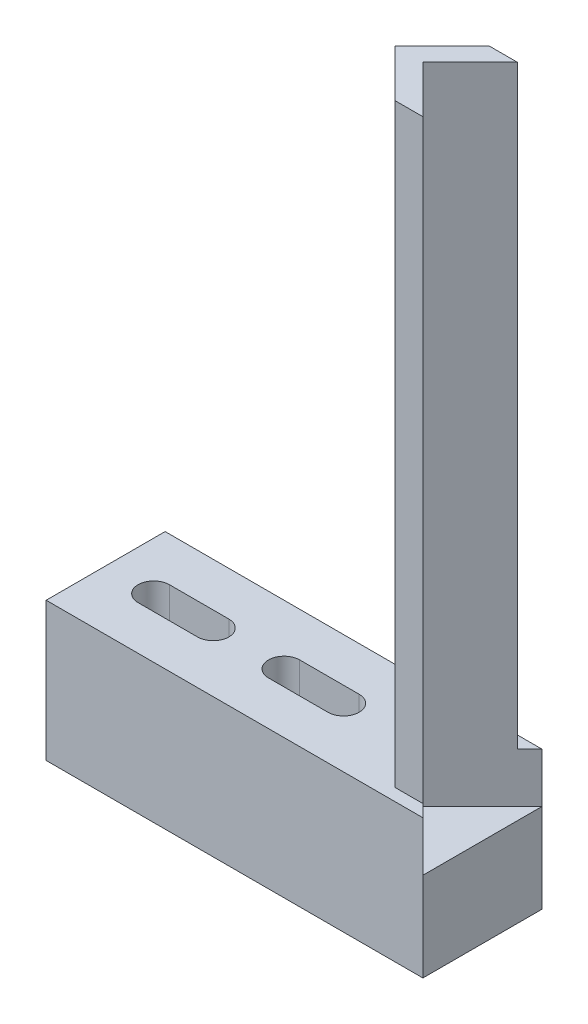
from build123d import *

# Parameters (mm, degrees)
SKETCH1_W           = 48.26
SKETCH1_H           = 17.78
BOSS_EXTRUDE1_DEPTH = 15.24
CUT_EXTRUDE1_DEPTH  = 6.37999994
CUT_EXTRUDE2_DEPTH  = 54.641528688
BOSS_EXTRUDE2_DEPTH = 76.2


with BuildPart() as part:
    # Sketch1 → Boss-Extrude1 (new body)
    with BuildSketch(Plane.XY):
        with Locations((24.13, 8.89)):
            Rectangle(SKETCH1_W, SKETCH1_H)
    extrude(amount=-BOSS_EXTRUDE1_DEPTH)

    # Sketch3 → Cut-Extrude1 (cut)
    with BuildSketch(Plane(origin=(0, 17.78, 0), x_dir=(1, 0, 0), z_dir=(0, 1, 0))):
        Polygon((48.26, 0), (48.26, 15.24), (46.685762979, 13.665762979), (40.64, 7.62), (46.685762979, 1.574237021), align=None)
    extrude(amount=-CUT_EXTRUDE1_DEPTH, mode=Mode.SUBTRACT)

    # Sketch4 → Cut-Extrude2 (cut, through all)
    with BuildSketch(Plane(origin=(0, 17.78, 0), x_dir=(1, 0, 0), z_dir=(0, 1, 0))):
        with BuildLine():
            Line((30.48, 5.62), (22.86, 5.62))
            ThreePointArc((22.86, 5.62), (20.86, 7.62), (22.86, 9.62))
            Line((22.86, 9.62), (30.48, 9.62))
            ThreePointArc((30.48, 9.62), (32.48, 7.62), (30.48, 5.62))
        make_face()
        with BuildLine():
            Line((13.78, 5.62), (6.16, 5.62))
            ThreePointArc((6.16, 5.62), (4.16, 7.62), (6.16, 9.62))
            Line((6.16, 9.62), (13.78, 9.62))
            ThreePointArc((13.78, 9.62), (15.78, 7.62), (13.78, 5.62))
        make_face()
    extrude(amount=-CUT_EXTRUDE2_DEPTH, mode=Mode.SUBTRACT)

    # Sketch3<3> → Boss-Extrude2 (add)
    with BuildSketch(Plane(origin=(0, 17.78, 0), x_dir=(1, 0, 0), z_dir=(0, 1, 0))):
        Polygon((40.64, 7.62), (46.685762979, 13.665762979), (43.093660531, 13.665762979), (37.047897552, 7.62), (43.093660531, 1.574237021), (46.685762979, 1.574237021), align=None)
    extrude(amount=BOSS_EXTRUDE2_DEPTH)


solid = part.part
